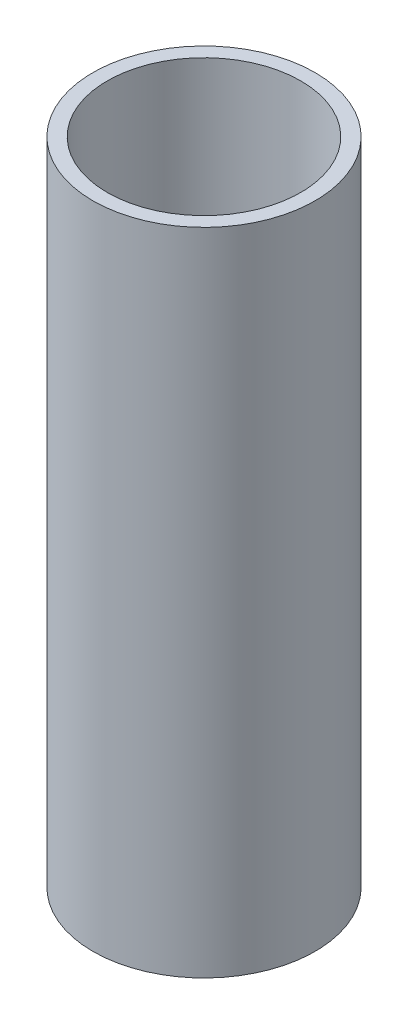
from build123d import *

# Parameters (mm, degrees)
SKETCH1_R           = 55
BOSS_EXTRUDE1_DEPTH = 321.84077816
SKETCH2_R           = 47.893760115
CUT_EXTRUDE1_DEPTH  = 332.106457936


with BuildPart() as part:
    # Sketch1 → Boss-Extrude1 (new body)
    with BuildSketch(Plane(origin=(0, 0, 0), x_dir=(1, 0, 0), z_dir=(0, 1, 0))):
        Circle(SKETCH1_R)
    extrude(amount=BOSS_EXTRUDE1_DEPTH)

    # Sketch2 → Cut-Extrude1 (cut, through all)
    with BuildSketch(Plane(origin=(0, 0, 0), x_dir=(1, 0, 0), z_dir=(0, 1, 0))):
        Circle(SKETCH2_R)
    extrude(amount=CUT_EXTRUDE1_DEPTH, mode=Mode.SUBTRACT)


solid = part.part
